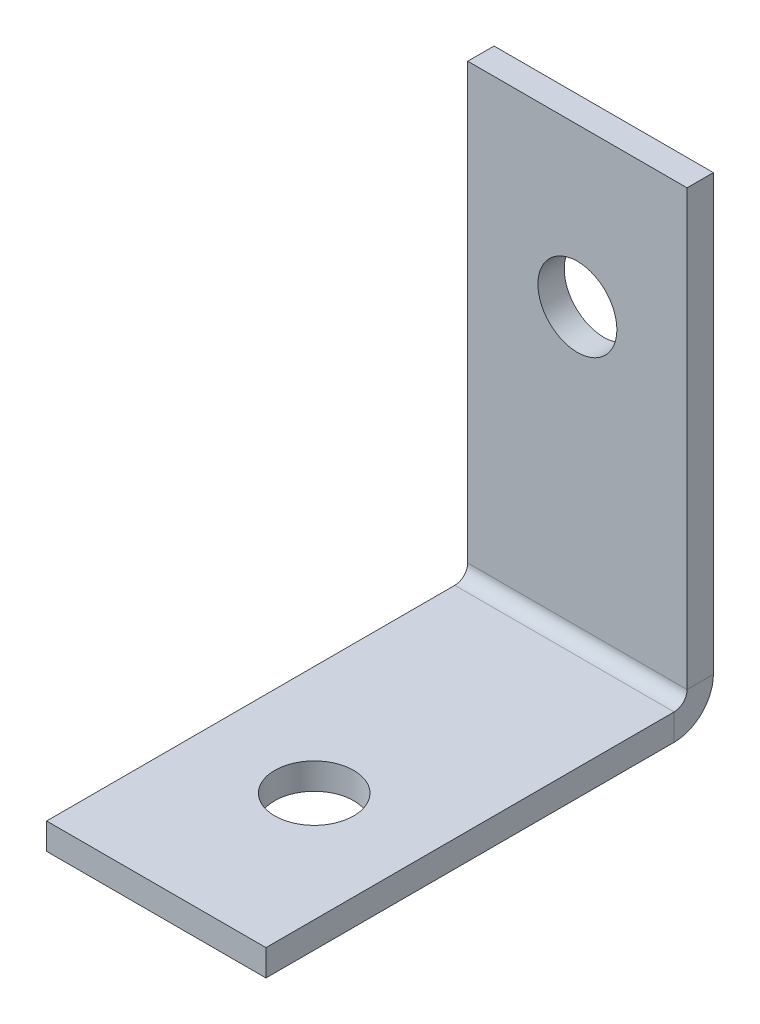
from build123d import *

# Parameters (mm, degrees)
SKETCH_1_W                       = 12.5
SKETCH_1_H                       = 25.5
SM_BASE_FLANGE_1_DEPTH           = 1.5
SM_EDGE_FLANGE_1_STRIP_W         = 7.4732
SM_EDGE_FLANGE_1_STRIP_H         = 1.5
SM_EDGE_FLANGE_1_STRIP_CUT_DEPTH = 12.5
SM_EDGE_FLANGE_1_DEPTH           = 12.5
SKETCH_6_R                       = 2.25
CUT_EXTRUDE_1_DEPTH              = 10
SKETCH_7_R                       = 2.25
CUT_EXTRUDE_2_DEPTH              = 10


# Sheet-metal steps are written as plain solids
with BuildPart() as part:
    # Sketch 1 → 基材-凸緣1 (new body)
    with BuildSketch(Plane(origin=(0, 0, 0), x_dir=(1, 0, 0), z_dir=(0, 1, 0))):
        Rectangle(SKETCH_1_W, SKETCH_1_H)
    extrude(amount=SM_BASE_FLANGE_1_DEPTH)

    # 邊線-凸緣1 strip (across the edge) → 邊線-凸緣1 strip cut (cut)
    with BuildSketch(Plane(origin=(6.25, 1.5, -12.75), x_dir=(0, 0, 1), z_dir=(-1, 0, 0))):
        with Locations((-1.5, -0.75)):
            Rectangle(SM_EDGE_FLANGE_1_STRIP_W, SM_EDGE_FLANGE_1_STRIP_H)
    extrude(amount=SM_EDGE_FLANGE_1_STRIP_CUT_DEPTH, mode=Mode.SUBTRACT)

    # 邊線-凸緣1 section (across the edge) → 邊線-凸緣1 (add)
    with BuildSketch(Plane(origin=(6.25, 1.5, -12.75), x_dir=(0, 0, 1), z_dir=(-1, 0, 0))):
        with BuildLine():
            Line((0, 0.7366), (0, 25.5))
            Line((0, 25.5), (1.5, 25.5))
            Line((1.5, 25.5), (1.5, 0.7366))
            ThreePointArc((1.5, 0.7366), (1.715745145, 0.215745145), (2.2366, 0))
            Line((2.2366, 0), (2.2366, -1.5))
            ThreePointArc((2.2366, -1.5), (0.655084973, -0.844915027), (0, 0.7366))
        make_face()
    extrude(amount=SM_EDGE_FLANGE_1_DEPTH)

    # 草圖6 → 伸長1 (cut)
    with BuildSketch(Plane(origin=(0, 1.5, 0), x_dir=(1, 0, 0), z_dir=(0, 1, 0))):
        with Locations(Location((0, -3.75, 0), (0, 0, 270))):
            Circle(SKETCH_6_R)
    extrude(amount=-CUT_EXTRUDE_1_DEPTH, mode=Mode.SUBTRACT)

    # 草圖7 → 伸長2 (cut)
    with BuildSketch(Plane.XY.offset(-11.25)):
        with Locations((0, 18)):
            Circle(SKETCH_7_R)
    extrude(amount=-CUT_EXTRUDE_2_DEPTH, mode=Mode.SUBTRACT)


solid = part.part
